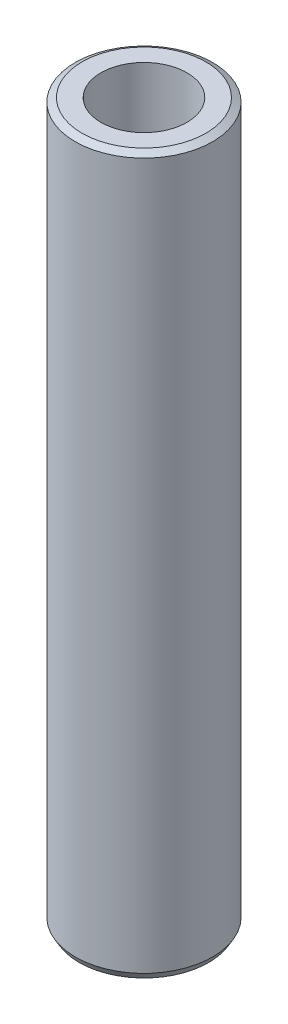
from build123d import *
from OCP.BRepFilletAPI import BRepFilletAPI_MakeChamfer

# Parameters (mm, degrees)
SKETCH1_R           = 57.5
BOSS_EXTRUDE1_DEPTH = 600
SKETCH2_R           = 36.015800992
CUT_EXTRUDE1_DEPTH  = 606.485342515
CHAMFER1_SIZE       = 3.279347201
CHAMFER1_SIZE2      = 5.679995967


with BuildPart() as part:
    # Sketch1 → Boss-Extrude1 (new body)
    with BuildSketch(Plane(origin=(0, 0, 0), x_dir=(1, 0, 0), z_dir=(0, 1, 0))):
        Circle(SKETCH1_R)
    extrude(amount=BOSS_EXTRUDE1_DEPTH)

    # Sketch2 → Cut-Extrude1 (cut, through all)
    with BuildSketch(Plane(origin=(0, 0, 0), x_dir=(1, 0, 0), z_dir=(0, 1, 0))):
        Circle(SKETCH2_R)
    extrude(amount=CUT_EXTRUDE1_DEPTH, mode=Mode.SUBTRACT)

    # Chamfer1: one chamfer whose edges measure the first distance from different faces: ONE call of the kernel's chamfer builder (chamfer() names one face for all edges)
    chamfer1_edges_1 = [part.edges().sort_by_distance(p)[0] for p in [
        (-57.5, 600, 0),
    ]]
    chamfer1_side_1 = [part.faces().sort_by_distance(p)[0] for p in [
        (-57.5, 300, 0),
    ]]
    chamfer1_edges_2 = [part.edges().sort_by_distance(p)[0] for p in [
        (-57.5, 0, 0),
    ]]
    chamfer1_side_2 = [part.faces().sort_by_distance(p)[0] for p in [
        (-55.873654403, 0, 0),
    ]]
    chamfer1 = BRepFilletAPI_MakeChamfer(part.part.solid().wrapped)
    for e in chamfer1_edges_1:
        chamfer1.Add(CHAMFER1_SIZE, CHAMFER1_SIZE2, e.wrapped, chamfer1_side_1[0].wrapped)  # the first distance lies on this face
    for e in chamfer1_edges_2:
        chamfer1.Add(CHAMFER1_SIZE, CHAMFER1_SIZE2, e.wrapped, chamfer1_side_2[0].wrapped)  # the first distance lies on this face
    add(Compound.cast(chamfer1.Shape()), mode=Mode.REPLACE)


solid = part.part
